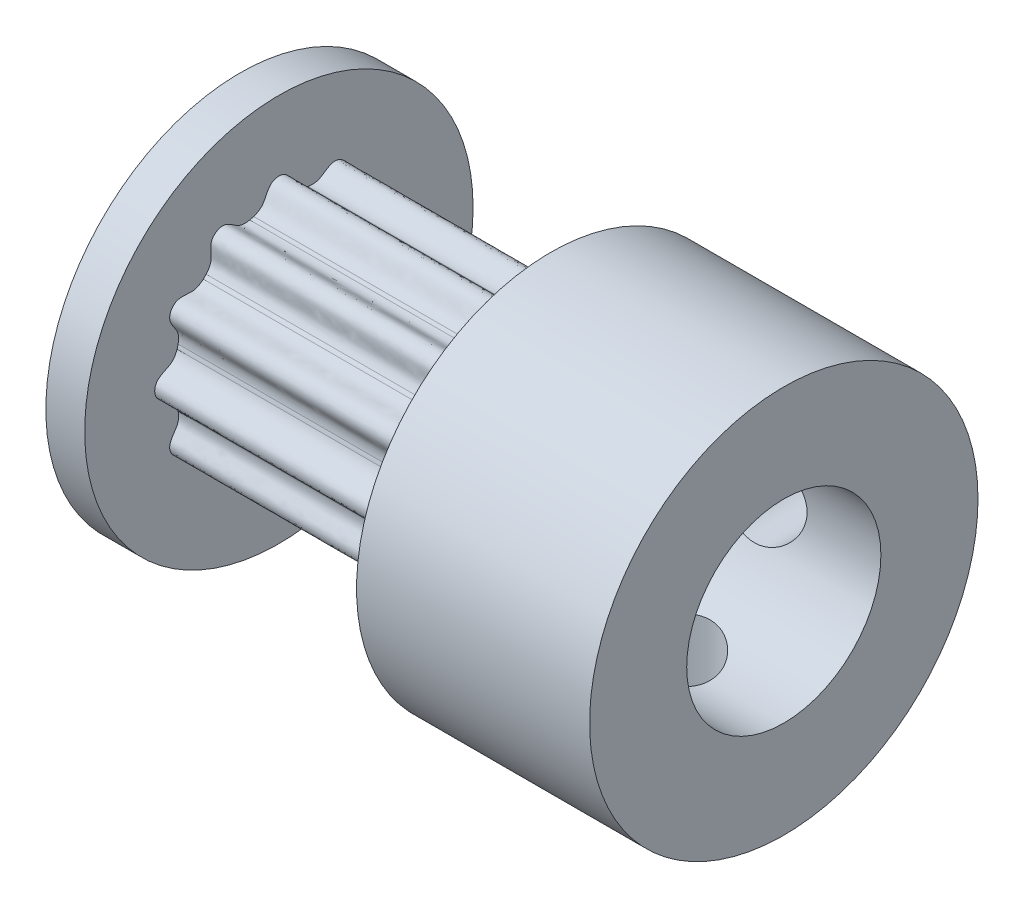
from build123d import *

# Parameters (mm, degrees)
TOOTH_DEPTH         = 9
TEETH_COUNT         = 12
SKETCH3_R           = 1.1
SETSCREWHOLE1_DEPTH = 6
SKETCH4_R           = 1.1
SETSCREWHOLE2_DEPTH = 6


with BuildPart() as part:
    # Sketch1 → Base (revolve)
    with BuildSketch(Plane(origin=(0, 0, 0), x_dir=(1, 0, 0), z_dir=(0, 1, 0))):
        Polygon((0, 2.5), (-14, 2.5), (-14, 5), (-13, 5), (-13, 2.7), (-6, 2.7), (-6, 5), (0, 5), align=None)
    revolve(axis=Axis((0, 0, 0), (-1, 0, 0)))

    # Sketch2 → Tooth (add)
    with BuildSketch(Plane.ZY.offset(14)):
        with BuildLine():
            add(Edge.make_bspline(
                [(-0.698010078, 2.605009074), (-0.579149714, 2.640123387), (-0.432927003, 2.70952093), (-0.293263805, 3.014827853), (-0.22723688, 3.122148687), (-0.139060677, 3.165998233), (-0.111390876, 3.179758275), (-0.051398578, 3.197922343), (0.051398578, 3.197922343), (0.111390876, 3.179758275), (0.139060677, 3.165998233), (0.22723688, 3.122148687), (0.293263805, 3.014827853), (0.432927003, 2.70952093), (0.579149714, 2.640123387), (0.698010078, 2.605009074)],
                knots=[0, 0, 0, 0, 0.168535538, 0.217849363, 0.409696975, 0.409696975, 0.409696975, 0.469898992, 0.530101008, 0.590303025, 0.590303025, 0.590303025, 0.782150637, 0.831464462, 1, 1, 1, 1], degree=3))
            ThreePointArc((-0.698010078, 2.605009074), (0, 2.7), (0.698010078, 2.605009074))
        make_face()
    tooth = extrude(amount=-TOOTH_DEPTH)

    # Teeth: Tooth ×12 about axis
    teeth_axis = Axis((0, 0, 0), (1, 0, 0))
    for i in range(1, TEETH_COUNT):
        add(tooth.rotate(teeth_axis, i * 360 / TEETH_COUNT))

    # Sketch3 → SetScrewHole1 (cut)
    with BuildSketch(Plane.XY):
        with Locations((-3, 0)):
            Circle(SKETCH3_R)
    extrude(amount=-SETSCREWHOLE1_DEPTH, mode=Mode.SUBTRACT)

    # Sketch4 → SetScrewHole2 (cut)
    with BuildSketch(Plane(origin=(0, 0, 0), x_dir=(1, 0, 0), z_dir=(0, 1, 0))):
        with Locations((-3, 0)):
            Circle(SKETCH4_R)
    extrude(amount=-SETSCREWHOLE2_DEPTH, mode=Mode.SUBTRACT)


solid = part.part
